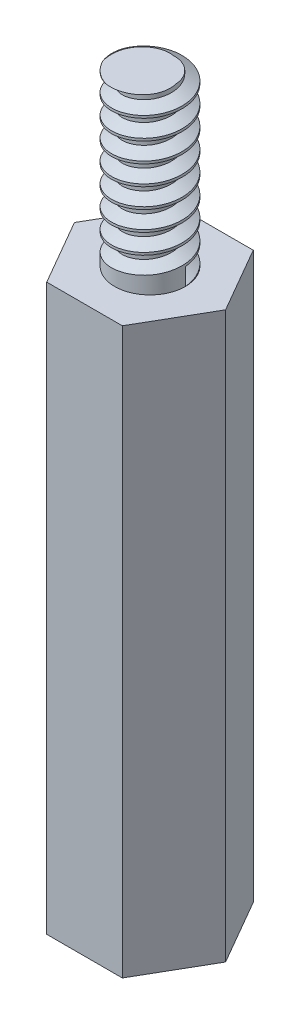
from build123d import *
from build123d.topology import SkipClean

# Parameters (mm, degrees)
BOSS_EXTRUDE1_DEPTH                                = 22.1
CBORE_FOR_M2_5_PAN_HEAD_MACHINE_SCREW1_D           = 2.9
CBORE_FOR_M2_5_PAN_HEAD_MACHINE_SCREW1_DEPTH       = 12
CBORE_FOR_M2_5_PAN_HEAD_MACHINE_SCREW1_CBORE_D     = 6
CBORE_FOR_M2_5_PAN_HEAD_MACHINE_SCREW1_CBORE_DEPTH = 2.1
CBORE_FOR_M2_5_PAN_HEAD_MACHINE_SCREW1_TIP         = 0.871247898
SKETCH4_R                                          = 1.25
BOSS_EXTRUDE2_DEPTH                                = 6
THREAD1_PITCH                                      = 0.7


with BuildPart() as part:
    # Sketch1 → Boss-Extrude1 (new body)
    with BuildSketch(Plane(origin=(0, 0, 0), x_dir=(1, 0, 0), z_dir=(0, 1, 0))):
        Polygon((1.338153586, -2.31775), (2.676307173, 0), (1.338153586, 2.31775), (-1.338153586, 2.31775), (-2.676307173, 0), (-1.338153586, -2.31775), align=None)
    extrude(amount=BOSS_EXTRUDE1_DEPTH)

    # CBORE for M2.5 Pan Head Machine Screw1
    with Locations(Plane(origin=(0, 0, 0), x_dir=(-1, 0, 0), z_dir=(0, -1, 0))):
        with Locations((0, 0)):
            CounterBoreHole(CBORE_FOR_M2_5_PAN_HEAD_MACHINE_SCREW1_D / 2, CBORE_FOR_M2_5_PAN_HEAD_MACHINE_SCREW1_CBORE_D / 2, CBORE_FOR_M2_5_PAN_HEAD_MACHINE_SCREW1_CBORE_DEPTH, depth=CBORE_FOR_M2_5_PAN_HEAD_MACHINE_SCREW1_DEPTH)
            with Locations((0, 0, -(CBORE_FOR_M2_5_PAN_HEAD_MACHINE_SCREW1_DEPTH + CBORE_FOR_M2_5_PAN_HEAD_MACHINE_SCREW1_TIP / 2))):  # 118° drill point
                Cone(0, CBORE_FOR_M2_5_PAN_HEAD_MACHINE_SCREW1_D / 2, CBORE_FOR_M2_5_PAN_HEAD_MACHINE_SCREW1_TIP, mode=Mode.SUBTRACT)

    # Sketch4 → Boss-Extrude2 (add)
    with BuildSketch(Plane(origin=(0, 22.1, 0), x_dir=(1, 0, 0), z_dir=(0, 1, 0))):
        with Locations(Location((0, 0, 0), (0, 0, 270))):
            Circle(SKETCH4_R)
    extrude(amount=BOSS_EXTRUDE2_DEPTH)

    # Thread1: the profile of Thread Profile1 profile screwed along a right-hand helix of 14.285714 turns, 6 arcs to a turn; built about Z, then put on its axis
    with SkipClean():  # the faces are left unmerged after this step: merging them gives an invalid solid
        thread1_z = Axis((0, 0, 0), (0, 0, 1))
        thread1_corners = [(1.2503, 0, -0.000173205), (1.2503, 0, 0.612673203), (0.871113888, 0, 0.393749999), (0.871113888, 0, 0.218749999)]
        with BuildLine(mode=Mode.PRIVATE) as thread1_profile:
            Line(thread1_corners[0], thread1_corners[1])
            Line(thread1_corners[1], thread1_corners[2])
            Line(thread1_corners[2], thread1_corners[3])
            Line(thread1_corners[3], thread1_corners[0])
        thread1_cap = Face(thread1_profile.wire())
        thread1_turn_angles = [0, 30, 60, 90, 120, 150, 180, 210, 240, 270, 300, 330, 360]
        thread1_turn_weights = [1, 0.8660254037844387, 1, 0.8660254037844387, 1, 0.8660254037844387, 1, 0.8660254037844387, 1, 0.8660254037844387, 1, 0.8660254037844387, 1]
        thread1_turn_rails = [Edge.make_bspline([Vector(p[0], p[1], 0).rotate(thread1_z, thread1_turn_angles[k]) / thread1_turn_weights[k] + Vector(0, 0, p[2] + THREAD1_PITCH * thread1_turn_angles[k] / 360) for k in range(13)], [0, 0, 0, 1, 1, 2, 2, 3, 3, 4, 4, 5, 5, 6, 6, 6], 2, thread1_turn_weights) for p in thread1_corners]
        thread1_turn_sides = [Face.make_surface_from_curves(thread1_turn_rails[p[0]], thread1_turn_rails[p[1]]) for p in [(0, 1), (1, 2), (2, 3), (3, 0)]]
        thread1_last_angles = [5040, 5070, 5100, 5121.428571429, 5142.857142857]
        thread1_last_weights = [1, 0.8660254037844387, 1, 0.9308737486442035, 1]
        thread1_last_rails = [Edge.make_bspline([Vector(p[0], p[1], 0).rotate(thread1_z, thread1_last_angles[k]) / thread1_last_weights[k] + Vector(0, 0, p[2] + THREAD1_PITCH * thread1_last_angles[k] / 360) for k in range(5)], [0, 0, 0, 1, 1, 2, 2, 2], 2, thread1_last_weights) for p in thread1_corners]
        thread1_last_sides = [Face.make_surface_from_curves(thread1_last_rails[p[0]], thread1_last_rails[p[1]]) for p in [(0, 1), (1, 2), (2, 3), (3, 0)]]
        thread1 = Plane(origin=(0, 22.1, 0), x_dir=(1, 0, 0), z_dir=(0, 1, 0)) * Solid(Shell([*[p.moved(Location((0, 0, THREAD1_PITCH * i))) for i in range(14) for p in thread1_turn_sides], *thread1_last_sides, thread1_cap, thread1_cap.rotate(thread1_z, 5142.857142857).moved(Location((0, 0, THREAD1_PITCH * 5142.857142857 / 360)))]))
        add(thread1, mode=Mode.SUBTRACT)


solid = part.part
